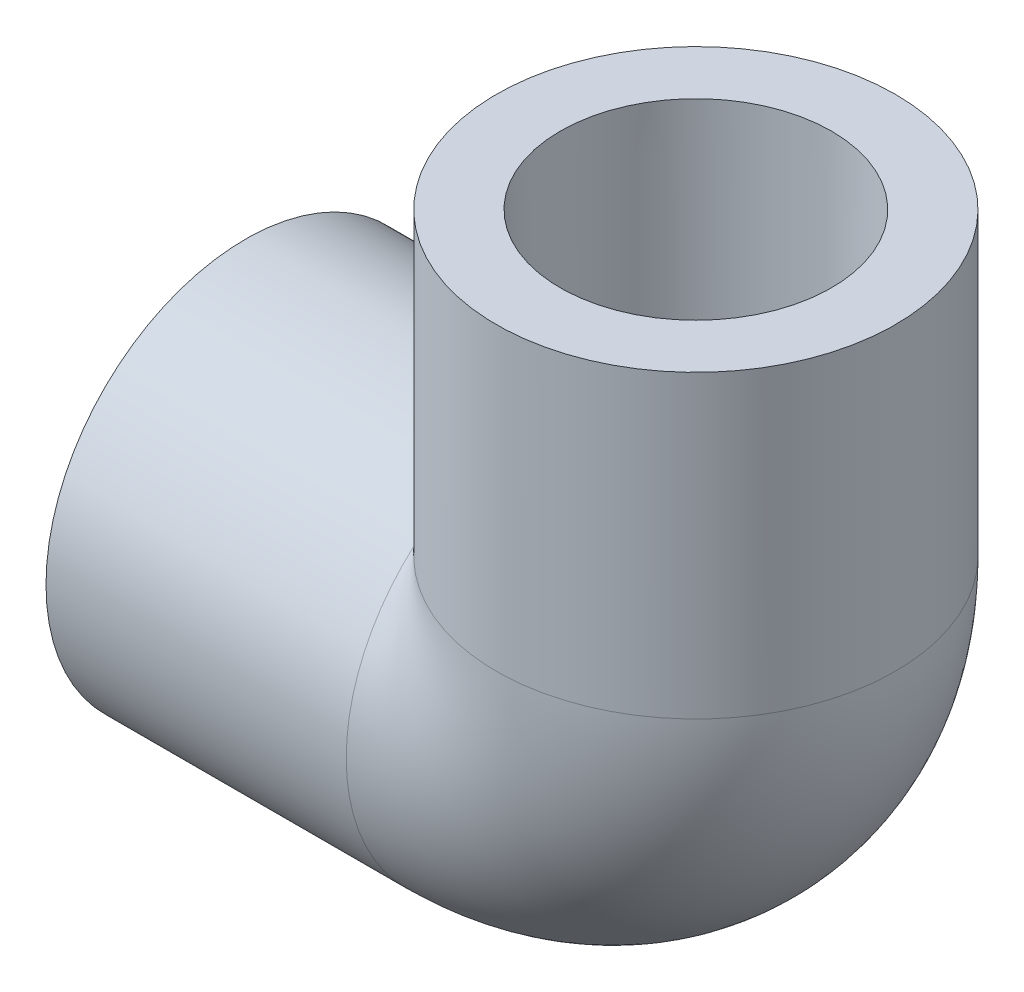
from build123d import *

# Parameters (mm, degrees)
SKETCH3_R   = 12.827
SKETCH3_R_2 = 5.3721


with BuildPart() as part:
    # Sketch1 → Revolve1 (revolve)
    with BuildSketch(Plane.XY):
        Polygon((-28.956, -12.827), (-9.652, -12.827), (-9.652, -8.5217), (-28.956, -8.7249), align=None)
    revolve(axis=Axis((-28.956, 0, 0), (1, 0, 0)))


with BuildPart() as body_2:
    # Sketch2 → Revolve2 (revolve)
    with BuildSketch(Plane.XY):
        Polygon((8.7249, 28.956), (8.5217, 9.652), (12.827, 9.652), (12.827, 28.956), align=None)
    revolve(axis=Axis((0, 0, 0), (0, 1, 0)))


with BuildPart() as sweep1_tool:
    # Sweep1: sweep along a path in Sketch4
    with BuildLine(Plane.XY) as sweep1_path:
        ThreePointArc((-9.652, 0), (-2.827005, 2.827005), (0, 9.652))
    # Sketch3 → Sweep1 (sweep)
    with BuildSketch(Plane(origin=(-9.652, 0, 0), x_dir=(0, 0, -1), z_dir=(1, 0, 0))):
        Circle(SKETCH3_R)
        Circle(SKETCH3_R_2, mode=Mode.SUBTRACT)
    sweep(path=sweep1_path.line)


with BuildPart() as part_1:
    add(part.part)


with BuildPart() as part_2:
    # Sweep1: joined with sweep1_tool
    add(part_1.part.fuse(sweep1_tool.part, body_2.part, tol=0.00001))


solid = part_2.part
